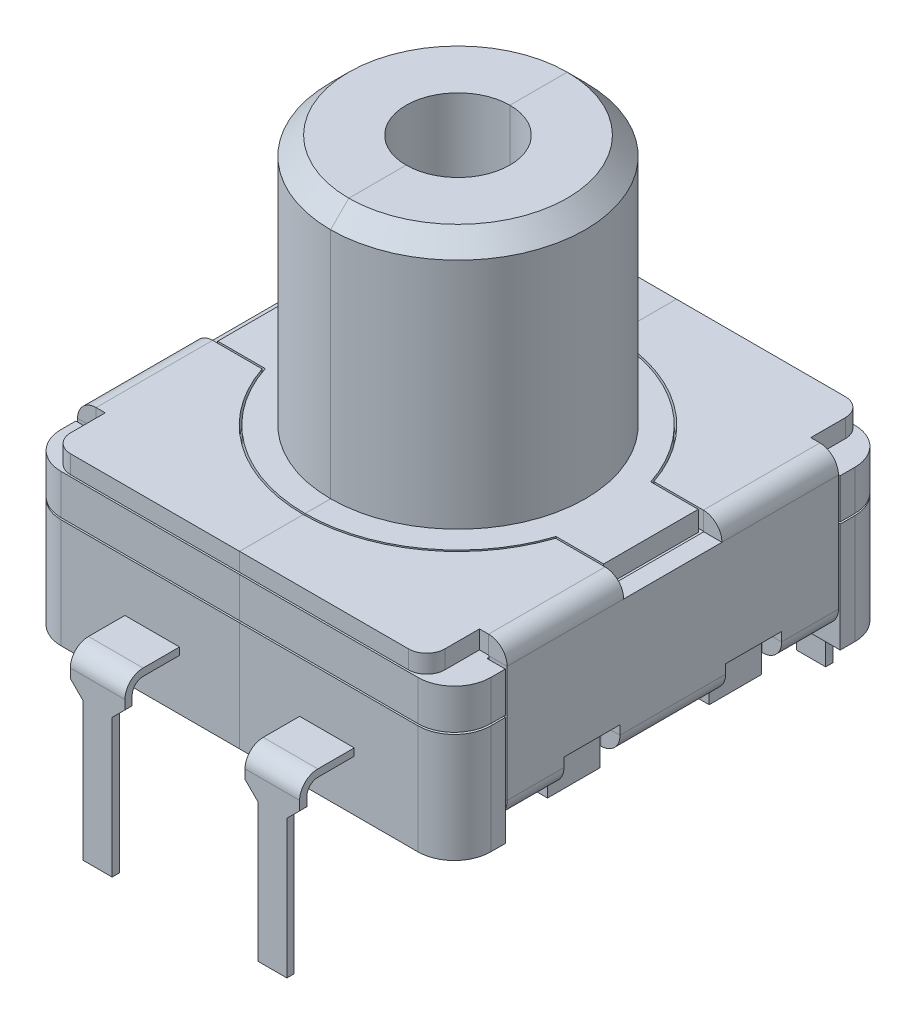
from build123d import *

# Parameters (mm, degrees)
EXTRUDE_1_DEPTH                   = 3
SKETCH_2_W                        = 1.5
SKETCH_2_H                        = 1.66
SKETCH_2_H_2                      = 1.5
CUT_EXTRUDE_1_DEPTH               = 1
EXTRUDE_2_DEPTH                   = 1.1
SKETCH_4_W                        = 1.5
SKETCH_4_H                        = 1.5
SKETCH_4_W_2                      = 0.75
EXTRUDE_3_DEPTH                   = 0.2
EXTRUDE_4_DEPTH                   = 0.2
EXTRUDE_5_DEPTH                   = 0.2
FILLET_1_R                        = 0.3
FILLET_2_R                        = 0.5
EXTRUDE_6_DEPTH                   = 0.55
SKETCH_8_W                        = 1
SKETCH_8_H                        = 9.2
CUT_EXTRUDE_3_DEPTH               = 13.106300013
SM_BASE_FLANGE_1_DEPTH            = 0.5
SM_EDGE_FLANGE_1_STRIP_W          = 2.02
SM_EDGE_FLANGE_1_STRIP_H          = 0.5
SM_EDGE_FLANGE_1_STRIP_CUT_DEPTH  = 3.2
SM_EDGE_FLANGE_1_RELIEF_W         = 2.27
SM_EDGE_FLANGE_1_RELIEF_H         = 0.25
SM_EDGE_FLANGE_1_RELIEF_CUT_DEPTH = 0.5
SM_EDGE_FLANGE_1_DEPTH            = 3.2
SM_EDGE_FLANGE_1_PROFILE_W        = 4.55
SM_EDGE_FLANGE_1_PROFILE_H        = 3.71
SM_EDGE_FLANGE_1_FLAT_DEPTH       = 0.5
SM_EDGE_FLANGE_2_STRIP_W          = 2.04
SM_EDGE_FLANGE_2_STRIP_H          = 0.5
SM_EDGE_FLANGE_2_STRIP_CUT_DEPTH  = 1.56
SM_EDGE_FLANGE_2_RELIEF_W         = 2.29
SM_EDGE_FLANGE_2_RELIEF_H         = 0.25
SM_EDGE_FLANGE_2_RELIEF_CUT_DEPTH = 0.5
SM_EDGE_FLANGE_2_DEPTH            = 1.56
SM_EDGE_FLANGE_3_STRIP_W          = 2.04
SM_EDGE_FLANGE_3_STRIP_H          = 0.5
SM_EDGE_FLANGE_3_STRIP_CUT_DEPTH  = 1.45
SM_EDGE_FLANGE_3_RELIEF_W         = 2.29
SM_EDGE_FLANGE_3_RELIEF_H         = 0.25
SM_EDGE_FLANGE_3_RELIEF_CUT_DEPTH = 0.5
SM_EDGE_FLANGE_3_DEPTH            = 1.45
SKETCH_39_W                       = 0.5
SKETCH_39_H                       = 1.04
CUT_EXTRUDE_5_DEPTH               = 0.77
EXTRUDE_8_DEPTH                   = 6.9
CHAMFER_1_SIZE                    = 0.5
SKETCH_45_R                       = 1.425
CUT_EXTRUDE_7_DEPTH               = 5


# Sheet-metal steps are written as plain solids
with BuildPart() as part:
    # Sketch 1 → 凸台-拉伸1 (new body)
    with BuildSketch(Plane(origin=(0, 0, 0), x_dir=(1, 0, 0), z_dir=(0, 1, 0))):
        with BuildLine():
            Line((5.9, 0), (5.9, -5))
            ThreePointArc((5.9, -5), (5.607106781, -5.707106781), (4.9, -6))
            Line((4.9, -6), (0, -6))
            Line((0, -6), (0, 0))
            Line((0, 0), (5.9, 0))
        make_face()
    extrude_1 = extrude(amount=EXTRUDE_1_DEPTH)

    # Sketch 2 → 切除-拉伸1 (cut)
    with BuildSketch(Plane.XZ):
        with Locations((5.15, 3.77)):
            Rectangle(SKETCH_2_W, SKETCH_2_H)
        with Locations((5.15, 0.75)):
            Rectangle(SKETCH_2_W, SKETCH_2_H_2)
    cut_extrude_1 = extrude(amount=-CUT_EXTRUDE_1_DEPTH, mode=Mode.SUBTRACT)

    # 镜向1: 凸台-拉伸1 across Front Plane
    add(extrude_1.mirror(Plane.XY))

    # Mirror 1 2: 切除-拉伸1 across Front Plane
    add(cut_extrude_1.mirror(Plane.XY), mode=Mode.SUBTRACT)

    # 草图4 → 凸台-拉伸3 (add)
    with BuildSketch(Plane(origin=(0, 1.6, 0), x_dir=(-1, 0, 0), z_dir=(0, -1, 0))):
        with Locations((-2.4, -6.75)):
            Rectangle(SKETCH_4_W, SKETCH_4_H)
        with Locations((-2.4, 6.75)):
            Rectangle(SKETCH_4_W, SKETCH_4_H)
        with Locations((-0.375, 6.75)):
            Rectangle(SKETCH_4_W_2, SKETCH_4_H)
    extrude(amount=EXTRUDE_3_DEPTH)

    # Sketch 5 → 凸台-拉伸4 (add)
    with BuildSketch(Plane.XY.offset(7.5)):
        Polygon((1.65, 0.85), (2, 0.5), (2, -3.3), (2.8, -3.3), (2.8, 0.5), (3.15, 0.85), (3.15, 1.4), (1.65, 1.4), align=None)
    extrude(amount=-EXTRUDE_4_DEPTH)

    # Sketch 6 → 凸台-拉伸5 (add)
    with BuildSketch(Plane.XY.offset(-7.5)):
        Polygon((1.65, 0.85), (2, 0.5), (2, -3.3), (2.8, -3.3), (2.8, 0.5), (3.15, 0.85), (3.15, 1.4), (1.65, 1.4), align=None)
        Polygon((0.75, 0.85), (0.4, 0.5), (0.4, -3.3), (0, -3.3), (0, 1.4), (0.75, 1.4), align=None)
    extrude(amount=EXTRUDE_5_DEPTH)

    # 圆角1
    fillet_1_edges = [part.edges().sort_by_distance(p)[0] for p in [
        (2.4, 1.4, 7.3),
        (2.4, 1.4, -7.3),
        (0.375, 1.4, -7.3),
    ]]
    fillet(fillet_1_edges, radius=FILLET_1_R)

    # 圆角2
    fillet_2_edges = [part.edges().sort_by_distance(p)[0] for p in [
        (2.4, 1.6, 7.5),
        (2.4, 1.6, -7.5),
        (0.375, 1.6, -7.5),
    ]]
    fillet(fillet_2_edges, radius=FILLET_2_R)


with BuildPart() as body_2:
    # 草图3 → 凸台-拉伸2 (new body)
    with BuildSketch(Plane(origin=(0, 3.05, 0), x_dir=(1, 0, 0), z_dir=(0, 1, 0))):
        with BuildLine():
            Line((5.9, 0), (0, 0))
            Line((0, 0), (0, -6))
            Line((0, -6), (4.9, -6))
            ThreePointArc((4.9, -6), (5.607106781, -5.707106781), (5.9, -5))
            Line((5.9, -5), (5.9, 0))
        make_face()
    extrude_2 = extrude(amount=EXTRUDE_2_DEPTH)

    # Mirror 1 3: 凸台-拉伸2 across Front Plane
    add(extrude_2.mirror(Plane.XY))

    # 草图7 → 凸台-拉伸6 (add)
    with BuildSketch(Plane(origin=(0, 4.15, 0), x_dir=(1, 0, 0), z_dir=(0, 1, 0))):
        with BuildLine():
            ThreePointArc((0, -4.2), (2.467792536, -3.398529094), (3.99374511, -1.3))
            ThreePointArc((3.99374511, -1.3), (4.2, 0), (3.99374511, 1.3))
            ThreePointArc((3.99374511, 1.3), (2.467792536, 3.398529094), (0, 4.2))
            Line((0, 4.2), (0, -4.2))
        make_face()
        with BuildLine():
            ThreePointArc((3.99374511, 1.3), (4.2, 0), (3.99374511, -1.3))
            Line((3.99374511, -1.3), (5.3, -1.3))
            Line((5.3, -1.3), (5.3, 1.3))
            Line((5.3, 1.3), (3.99374511, 1.3))
        make_face()
    extrude(amount=EXTRUDE_6_DEPTH)


with BuildPart() as cut_extrude_3_tool:
    # 草图8 → 切除-拉伸3 (new, through all)
    with BuildSketch(Plane(origin=(0, 4.15, 0), x_dir=(1, 0, 0), z_dir=(0, 1, 0))):
        with Locations((5.9, 0)):
            Rectangle(SKETCH_8_W, SKETCH_8_H)
    extrude(amount=-CUT_EXTRUDE_3_DEPTH)


with BuildPart() as part_1:
    add(part.part)

    # 切除-拉伸3: cut by cut_extrude_3_tool
    add(cut_extrude_3_tool.part, mode=Mode.SUBTRACT)


with BuildPart() as body_2_1:
    add(body_2.part)

    # 切除-拉伸3: cut by cut_extrude_3_tool
    add(cut_extrude_3_tool.part, mode=Mode.SUBTRACT)



with BuildPart() as body_3:
    # Sketch 9 → 基体-法兰1 (new body)
    with BuildSketch(Plane(origin=(0, 4.2, 0), x_dir=(1, 0, 0), z_dir=(0, 1, 0))):
        with BuildLine():
            Line((5.9, -4.6), (5.14, -4.6))
            Line((5.14, -4.6), (5.14, -5.5))
            ThreePointArc((5.14, -5.5), (4.993553391, -5.853553391), (4.64, -6))
            Line((4.64, -6), (0, -6))
            Line((0, -6), (0, -4.25))
            ThreePointArc((0, -4.25), (2.482438317, -3.449637662), (4.029888336, -1.35))
            Line((4.029888336, -1.35), (5.9, -1.35))
            Line((5.9, -1.35), (5.9, -4.6))
        make_face()
    extrude(amount=SM_BASE_FLANGE_1_DEPTH)

    # 边线-法兰1 strip (across the edge) → 边线-法兰1 strip cut (cut)
    with BuildSketch(Plane(origin=(5.9, 4.2, 1.35), x_dir=(-1, 0, 0), z_dir=(0, 0, 1))):
        with Locations((-0.5, -0.25)):
            Rectangle(SM_EDGE_FLANGE_1_STRIP_W, SM_EDGE_FLANGE_1_STRIP_H)
    extrude(amount=SM_EDGE_FLANGE_1_STRIP_CUT_DEPTH, mode=Mode.SUBTRACT)

    # 边线-法兰1 relief (on the sheet) → 边线-法兰1 relief cut (cut)
    with BuildSketch(Plane(origin=(5.39, 4.2, 1.35), x_dir=(-1, 0, 0), z_dir=(0, -1, 0))):
        with Locations((-0.885, -3.325)):
            Rectangle(SM_EDGE_FLANGE_1_RELIEF_W, SM_EDGE_FLANGE_1_RELIEF_H)
    extrude(amount=-SM_EDGE_FLANGE_1_RELIEF_CUT_DEPTH, mode=Mode.SUBTRACT)

    # 边线-法兰1 bend section (across the edge) → 边线-法兰1 (add)
    with BuildSketch(Plane(origin=(5.9, 4.2, 1.35), x_dir=(-1, 0, 0), z_dir=(0, 0, 1))):
        with BuildLine():
            Line((0, 0.01), (0.5, 0.01))
            ThreePointArc((0.5, 0.01), (0.502928932, 0.002928932), (0.51, 0))
            Line((0.51, 0), (0.51, -0.5))
            ThreePointArc((0.51, -0.5), (0.149375542, -0.350624458), (0, 0.01))
        make_face()
    extrude(amount=SM_EDGE_FLANGE_1_DEPTH)

    # 边线-法兰1 profile (on flange) → 边线-法兰1 flat (add)
    with BuildSketch(Plane(origin=(5.9, 4.2, 0), x_dir=(0, 0, 1), z_dir=(1, 0, 0))):
        with Locations((2.275, 1.865)):
            Rectangle(SM_EDGE_FLANGE_1_PROFILE_W, SM_EDGE_FLANGE_1_PROFILE_H)
    extrude(amount=-SM_EDGE_FLANGE_1_FLAT_DEPTH)

    # 边线-法兰2 strip (across the edge) → 边线-法兰2 strip cut (cut)
    with BuildSketch(Plane(origin=(5.4, 0.48, 2.99), x_dir=(0, 1, 0), z_dir=(0, 0, 1))):
        with Locations((-0.5, -0.25)):
            Rectangle(SM_EDGE_FLANGE_2_STRIP_W, SM_EDGE_FLANGE_2_STRIP_H)
    extrude(amount=SM_EDGE_FLANGE_2_STRIP_CUT_DEPTH, mode=Mode.SUBTRACT)

    # 边线-法兰2 relief (on the sheet) → 边线-法兰2 relief cut (cut)
    with BuildSketch(Plane(origin=(5.4, 1, 2.99), x_dir=(0, 1, 0), z_dir=(-1, 0, 0))):
        with Locations((-0.895, 0.125)):
            Rectangle(SM_EDGE_FLANGE_2_RELIEF_W, SM_EDGE_FLANGE_2_RELIEF_H)
    extrude(amount=-SM_EDGE_FLANGE_2_RELIEF_CUT_DEPTH, mode=Mode.SUBTRACT)

    # 边线-法兰2 section (across the edge) → 边线-法兰2 (add)
    with BuildSketch(Plane(origin=(5.4, 0.48, 2.99), x_dir=(0, 1, 0), z_dir=(0, 0, 1))):
        with BuildLine():
            Line((0, 0.02), (0, 0.95))
            Line((0, 0.95), (0.5, 0.95))
            Line((0.5, 0.95), (0.5, 0.02))
            ThreePointArc((0.5, 0.02), (0.505857864, 0.005857864), (0.52, 0))
            Line((0.52, 0), (0.52, -0.5))
            ThreePointArc((0.52, -0.5), (0.152304474, -0.347695526), (0, 0.02))
        make_face()
    extrude(amount=SM_EDGE_FLANGE_2_DEPTH)

    # 边线-法兰3 strip (across the edge) → 边线-法兰3 strip cut (cut)
    with BuildSketch(Plane(origin=(5.4, 0.48, 0), x_dir=(0, 1, 0), z_dir=(0, 0, 1))):
        with Locations((-0.5, -0.25)):
            Rectangle(SM_EDGE_FLANGE_3_STRIP_W, SM_EDGE_FLANGE_3_STRIP_H)
    extrude(amount=SM_EDGE_FLANGE_3_STRIP_CUT_DEPTH, mode=Mode.SUBTRACT)

    # 边线-法兰3 relief (on the sheet) → 边线-法兰3 relief cut (cut)
    with BuildSketch(Plane(origin=(5.4, 1, 0), x_dir=(0, 1, 0), z_dir=(-1, 0, 0))):
        with Locations((-0.895, -1.575)):
            Rectangle(SM_EDGE_FLANGE_3_RELIEF_W, SM_EDGE_FLANGE_3_RELIEF_H)
    extrude(amount=-SM_EDGE_FLANGE_3_RELIEF_CUT_DEPTH, mode=Mode.SUBTRACT)

    # 边线-法兰3 section (across the edge) → 边线-法兰3 (add)
    with BuildSketch(Plane(origin=(5.4, 0.48, 0), x_dir=(0, 1, 0), z_dir=(0, 0, 1))):
        with BuildLine():
            Line((0, 0.02), (0, 0.95))
            Line((0, 0.95), (0.5, 0.95))
            Line((0.5, 0.95), (0.5, 0.02))
            ThreePointArc((0.5, 0.02), (0.505857864, 0.005857864), (0.52, 0))
            Line((0.52, 0), (0.52, -0.5))
            ThreePointArc((0.52, -0.5), (0.152304474, -0.347695526), (0, 0.02))
        make_face()
    extrude(amount=SM_EDGE_FLANGE_3_DEPTH)

    # 草图39 → 切除-拉伸5 (cut)
    with BuildSketch(Plane.XZ.offset(-0.48)):
        with Locations((5.65, 2.22)):
            Rectangle(SKETCH_39_W, SKETCH_39_H)
    extrude(amount=-CUT_EXTRUDE_5_DEPTH, mode=Mode.SUBTRACT)


with BuildPart() as body_4:
    # 镜向2: mirrored copy
    add(body_3.part.mirror(Plane(origin=(5.9, 4.2, 0), x_dir=(1, 0, 0), z_dir=(0, 0, 1))))


with BuildPart() as body_2_2:
    add(body_2_1.part)

    add(body_4.part)  # 凸台-拉伸8 merges body 4

    add(body_3.part)  # 凸台-拉伸8 merges body 3
    # 草图41 → 凸台-拉伸8 (add)
    with BuildSketch(Plane(origin=(0, 4.7, 0), x_dir=(1, 0, 0), z_dir=(0, 1, 0))):
        with BuildLine():
            Line((0, 3.5), (0, -3.5))
            ThreePointArc((0, -3.5), (3.5, 0), (0, 3.5))
        make_face()
    extrude(amount=EXTRUDE_8_DEPTH)

    # 倒角1
    chamfer_1_edges = [body_2_2.edges().sort_by_distance(p)[0] for p in [
        (3.5, 11.6, 0),
    ]]
    chamfer(chamfer_1_edges, length=CHAMFER_1_SIZE)

    # 草图45 → 切除-拉伸7 (cut)
    with BuildSketch(Plane(origin=(0, 11.6, 0), x_dir=(1, 0, 0), z_dir=(0, 1, 0))):
        Circle(SKETCH_45_R)
    extrude(amount=-CUT_EXTRUDE_7_DEPTH, mode=Mode.SUBTRACT)


with BuildPart() as body_3_2:
    # 镜向13: mirrored copy
    add(body_2_2.part.mirror(Plane(origin=(0, 4.15, 0), x_dir=(0, 0, 1), z_dir=(1, 0, 0))))


with BuildPart() as body_4_2:
    # Mirror 13 2: mirrored copy
    add(part_1.part.mirror(Plane(origin=(0, 4.15, 0), x_dir=(0, 0, 1), z_dir=(1, 0, 0))))


solid = Compound([part_1.part, body_2_2.part, body_3_2.part, body_4_2.part])
